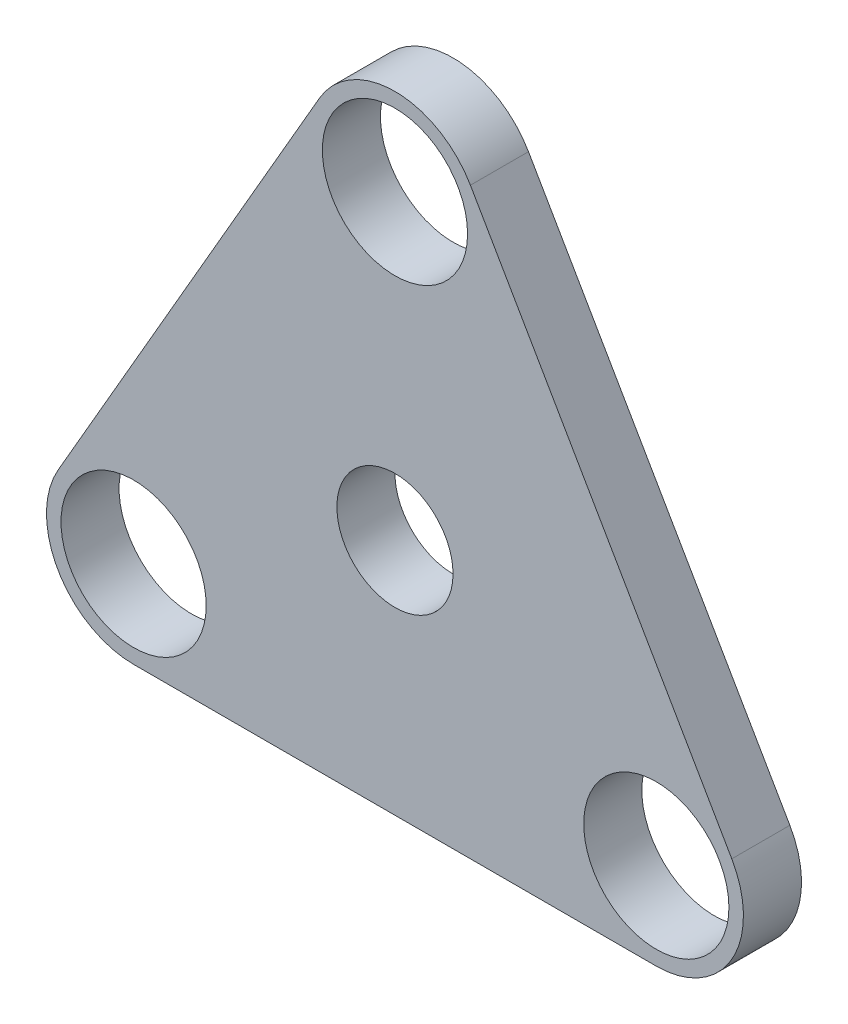
from build123d import *

# Parameters (mm, degrees)
SKETCH1_R           = 6.35
SKETCH1_R_2         = 7.9375
BOSS_EXTRUDE1_DEPTH = 6.35


with BuildPart() as part:
    # Sketch1 → Boss-Extrude1 (new body)
    with BuildSketch(Plane.XY):
        with BuildLine():
            Line((-8.248891971, 37.758067884), (-36.823891971, -11.735283942))
            ThreePointArc((-36.823891971, -11.735283942), (-36.823891971, -21.260283942), (-28.575, -26.022783942))
            Line((-28.575, -26.022783942), (28.575, -26.022783942))
            ThreePointArc((28.575, -26.022783942), (36.823891971, -21.260283942), (36.823891971, -11.735283942))
            Line((36.823891971, -11.735283942), (8.248891971, 37.758067884))
            ThreePointArc((8.248891971, 37.758067884), (0, 42.520567884), (-8.248891971, 37.758067884))
        make_face()
        Circle(SKETCH1_R, mode=Mode.SUBTRACT)
        with Locations((-28.575, -16.497783942)):
            Circle(SKETCH1_R_2, mode=Mode.SUBTRACT)
        with Locations((0, 32.995567884)):
            Circle(SKETCH1_R_2, mode=Mode.SUBTRACT)
        with Locations((28.575, -16.497783942)):
            Circle(SKETCH1_R_2, mode=Mode.SUBTRACT)
    extrude(amount=BOSS_EXTRUDE1_DEPTH)


solid = part.part
